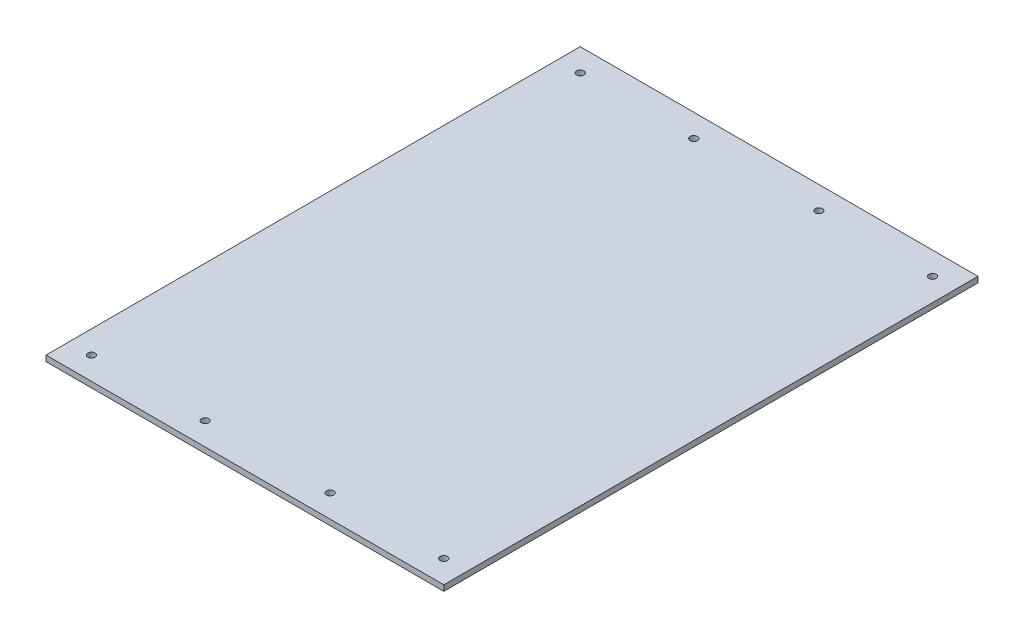
from build123d import *

# Parameters (mm, degrees)
SKETCH1_W                = 350
SKETCH1_H                = 470
BOSS_EXTRUDE1_DEPTH      = 5
M6_CLEARANCE_HOLE1_D     = 6.4
M6_CLEARANCE_HOLE1_DEPTH = 10
M6_CLEARANCE_HOLE1_TIP   = 1.922753981


with BuildPart() as part:
    # Sketch1 → Boss-Extrude1 (new body)
    with BuildSketch(Plane(origin=(0, 0, 0), x_dir=(1, 0, 0), z_dir=(0, 1, 0))):
        Rectangle(SKETCH1_W, SKETCH1_H)
    extrude(amount=BOSS_EXTRUDE1_DEPTH)

    # M6 Clearance Hole1
    with Locations(Plane(origin=(0, 5, 0), x_dir=(1, 0, 0), z_dir=(0, 1, 0))):
        with Locations((-155, 215), (-55, 215), (55, 215), (155, 215), (-155, -215), (-55, -215), (55, -215), (155, -215)):
            Hole(M6_CLEARANCE_HOLE1_D / 2, depth=M6_CLEARANCE_HOLE1_DEPTH)
            with Locations((0, 0, -(M6_CLEARANCE_HOLE1_DEPTH + M6_CLEARANCE_HOLE1_TIP / 2))):  # 118° drill point
                Cone(0, M6_CLEARANCE_HOLE1_D / 2, M6_CLEARANCE_HOLE1_TIP, mode=Mode.SUBTRACT)


solid = part.part
